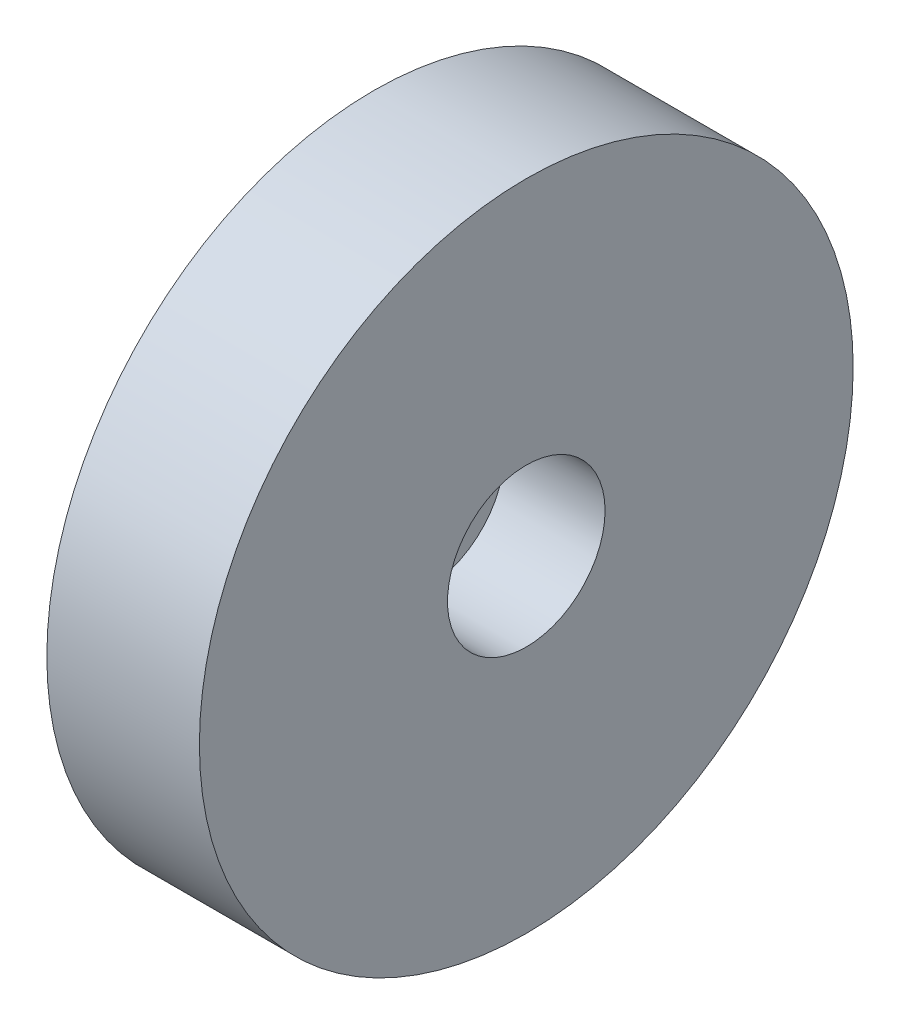
from build123d import *
from build123d.topology import SkipClean

# Parameters (mm, degrees)
BASPROSKE_W         = 4.55
BASPROSKE_H         = 12
TOOTHCUT_DEPTH      = 18.569931702
TEETHCUTS_COUNT     = 22
TEETHCUTS_ANGLE     = 343.636363636
BORSKE_R            = 1.35
BORE_DEPTH          = 50.0000508
SKETCH1_R           = 4
SKETCH1_R_2         = 1.35
BOSS_EXTRUDE1_DEPTH = 4
SKETCH1_4_R         = 6
SKETCH1_4_R_2       = 4
BOSS_EXTRUDE2_DEPTH = 1
SKETCH2_2_R         = 2.35
CUT_EXTRUDE1_DEPTH  = 3


with BuildPart() as part:
    # BasProSke → Base-Revolve (revolve)
    with BuildSketch(Plane(origin=(0, 0, 0), x_dir=(1, 0, 0), z_dir=(0, 1, 0))):
        with Locations((2.275, 6)):
            Rectangle(BASPROSKE_W, BASPROSKE_H)
    revolve(axis=Axis((-10, 0, 0), (1, 0, 0)))

    # TooCutSke → ToothCut (cut, through all)
    with BuildSketch(Plane(origin=(0, 0, 0), x_dir=(0, 0, -1), z_dir=(1, 0, 0))):
        with BuildLine():
            ThreePointArc((1.75558357, 9.589626027), (0, 9.749), (-1.75558357, 9.589626027))
            ThreePointArc((-1.75558357, 9.589626027), (-2.23669679, 10.703810571), (-3.003890094, 11.644178351))
            ThreePointArc((-3.003890094, 11.644178351), (0, 12.0254), (3.003890094, 11.644178351))
            ThreePointArc((3.003890094, 11.644178351), (2.23669679, 10.703810571), (1.75558357, 9.589626027))
        make_face()
    toothcut = extrude(amount=TOOTHCUT_DEPTH, mode=Mode.SUBTRACT)

    # TeethCuts: ToothCut ×22 about axis
    teethcuts_axis = Axis((-10, 0, 0), (1, 0, 0))
    for i in range(1, TEETHCUTS_COUNT):
        add(toothcut.rotate(teethcuts_axis, i * TEETHCUTS_ANGLE / (TEETHCUTS_COUNT - 1)), mode=Mode.SUBTRACT)

    # BorSke → Bore (cut, symmetric)
    with BuildSketch(Plane(origin=(0, 0, 0), x_dir=(0, 0, -1), z_dir=(1, 0, 0))):
        Circle(BORSKE_R)
    extrude(amount=BORE_DEPTH, both=True, mode=Mode.SUBTRACT)

    # Sketch1 → Boss-Extrude1 (add)
    with SkipClean():  # the faces are left unmerged after this step: merging them gives an invalid solid
        with BuildSketch(Plane.ZY):
            Circle(SKETCH1_R)
            Circle(SKETCH1_R_2, mode=Mode.SUBTRACT)
        extrude(amount=BOSS_EXTRUDE1_DEPTH)

    # Sketch1<4> → Boss-Extrude2 (add)
    with SkipClean():  # the faces are left unmerged after this step: merging them gives an invalid solid
        with BuildSketch(Plane.ZY):
            Circle(SKETCH1_4_R)
            Circle(SKETCH1_4_R_2, mode=Mode.SUBTRACT)
        extrude(amount=BOSS_EXTRUDE2_DEPTH)

    # Sketch2<2> → Cut-Extrude1 (cut)
    with SkipClean():  # the faces are left unmerged after this step: merging them gives an invalid solid
        with BuildSketch(Plane(origin=(4.55, 0, 0), x_dir=(0, 0, -1), z_dir=(1, 0, 0))):
            Circle(SKETCH2_2_R)
        extrude(amount=-CUT_EXTRUDE1_DEPTH, mode=Mode.SUBTRACT)


solid = part.part
